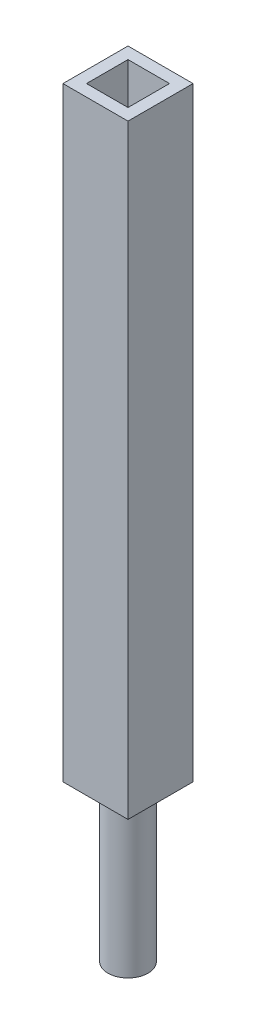
from build123d import *

# Parameters (mm, degrees)
SKETCH1_W           = 11.938
SKETCH1_H           = 11.938
BOSS_EXTRUDE1_DEPTH = 213.106
SKETCH2_R           = 3.68046
BOSS_EXTRUDE2_DEPTH = 22.225
BOSS_EXTRUDE3_START = 28.575
SKETCH3_R           = 3.68046
BOSS_EXTRUDE3_DEPTH = 28.575
SKETCH4_W           = 4.572
SKETCH4_H           = 4.572
BOSS_EXTRUDE4_DEPTH = 15.24
SKETCH5_R           = 13.051144527
CUT_EXTRUDE1_DEPTH  = 139.573
SKETCH6_W           = 7.62
SKETCH6_H           = 7.62
CUT_EXTRUDE2_DEPTH  = 12.7


with BuildPart() as part:
    # Sketch1 → Boss-Extrude1 (new body)
    with BuildSketch(Plane(origin=(0, 0, 0), x_dir=(1, 0, 0), z_dir=(0, 1, 0))):
        Rectangle(SKETCH1_W, SKETCH1_H)
    extrude(amount=BOSS_EXTRUDE1_DEPTH)

    # Sketch2 → Boss-Extrude2 (add)
    with BuildSketch(Plane(origin=(0, 213.106, 0), x_dir=(1, 0, 0), z_dir=(0, 1, 0))):
        Circle(SKETCH2_R)
    extrude(amount=BOSS_EXTRUDE2_DEPTH)

    # Sketch3 → Boss-Extrude3 (add)
    with BuildSketch(Plane(origin=(0, 0, 0), x_dir=(-1, 0, 0), z_dir=(0, -1, 0)).offset(BOSS_EXTRUDE3_START)):
        Circle(SKETCH3_R)
    extrude(amount=-BOSS_EXTRUDE3_DEPTH)

    # Sketch4 → Boss-Extrude4 (add)
    with BuildSketch(Plane(origin=(0, 235.331, 0), x_dir=(1, 0, 0), z_dir=(0, 1, 0))):
        Rectangle(SKETCH4_W, SKETCH4_H)
    extrude(amount=BOSS_EXTRUDE4_DEPTH)

    # Sketch5 → Cut-Extrude1 (cut)
    with BuildSketch(Plane(origin=(0, 250.571, 0), x_dir=(1, 0, 0), z_dir=(0, 1, 0))):
        Circle(SKETCH5_R)
    extrude(amount=-CUT_EXTRUDE1_DEPTH, mode=Mode.SUBTRACT)

    # Sketch6 → Cut-Extrude2 (cut)
    with BuildSketch(Plane(origin=(0, 110.998, 0), x_dir=(1, 0, 0), z_dir=(0, 1, 0))):
        Rectangle(SKETCH6_W, SKETCH6_H)
    extrude(amount=-CUT_EXTRUDE2_DEPTH, mode=Mode.SUBTRACT)


solid = part.part
